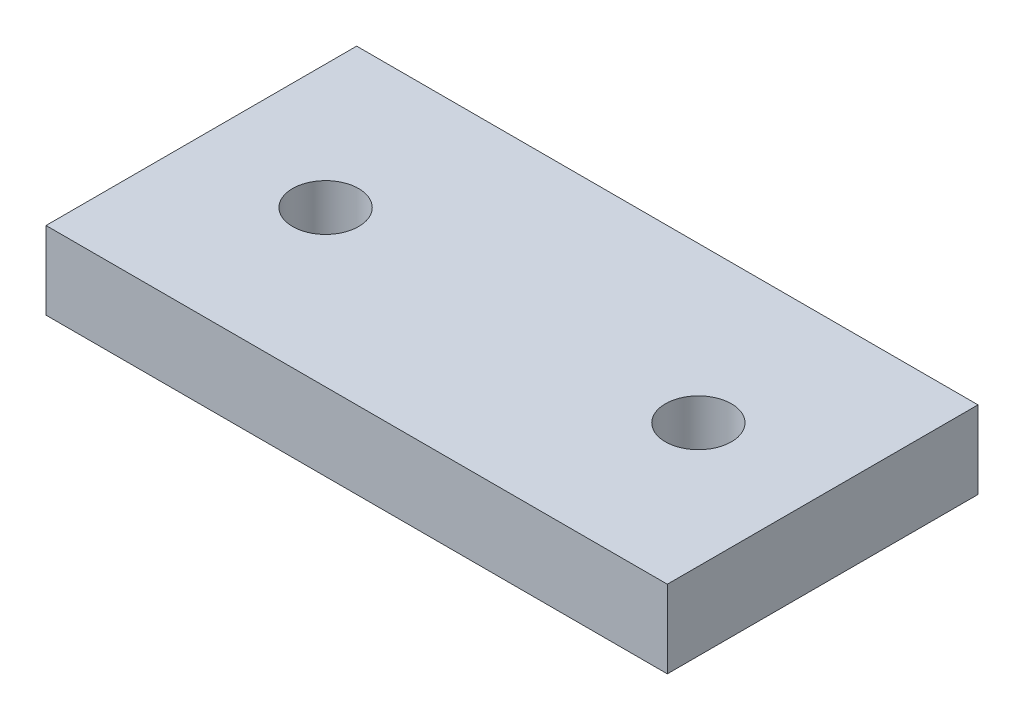
from build123d import *

# Parameters (mm, degrees)
SKETCH1_W           = 40
SKETCH1_H           = 20
SKETCH1_R           = 2.125
BOSS_EXTRUDE1_DEPTH = 5


with BuildPart() as part:
    # Sketch1 → Boss-Extrude1 (new body)
    with BuildSketch(Plane(origin=(0, 0, 0), x_dir=(1, 0, 0), z_dir=(0, 1, 0))):
        Rectangle(SKETCH1_W, SKETCH1_H)
        with Locations((-12, 0)):
            Circle(SKETCH1_R, mode=Mode.SUBTRACT)
        with Locations((12, 0)):
            Circle(SKETCH1_R, mode=Mode.SUBTRACT)
    extrude(amount=BOSS_EXTRUDE1_DEPTH)


solid = part.part
